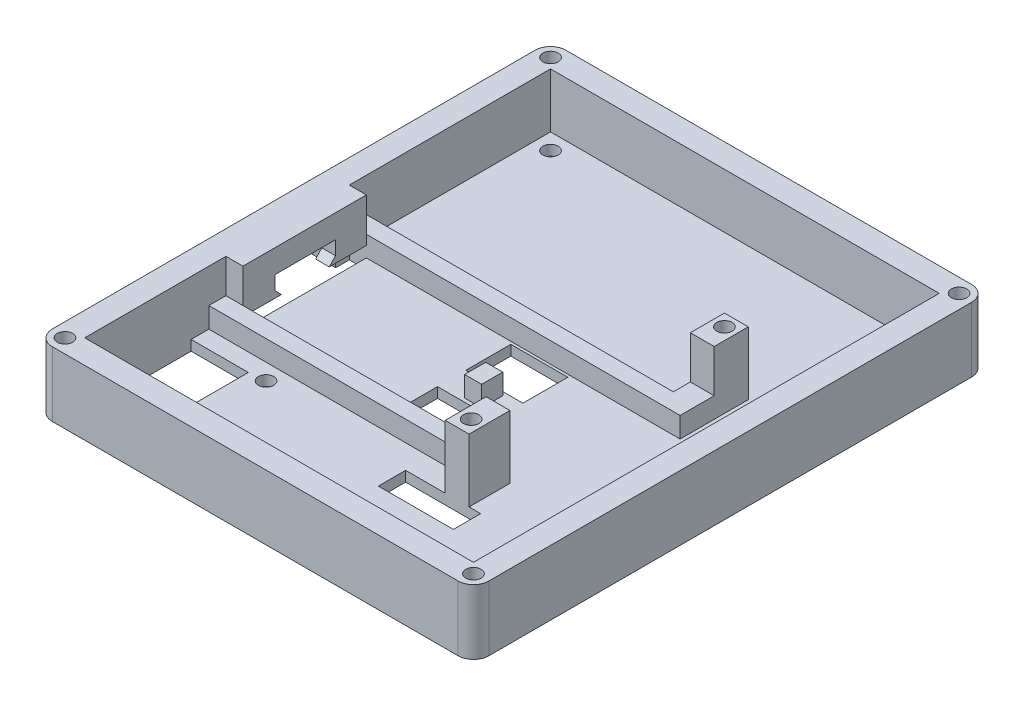
from build123d import *

# Parameters (mm, degrees)
SKETCH2_W              = 64
SKETCH2_H              = 75.2942
BASE_DEPTH             = 1.5
SKETCH6_W              = 64
SKETCH6_H              = 75.2942
SKETCH6_W_2            = 57
SKETCH6_H_2            = 68.2942
OUTSIDE_WALLS_DEPTH    = 8
SKETCH3_W              = 44.5
SKETCH3_H              = 2.5
SKETCH3_W_2            = 37.65
DIVIDER_WALLS_DEPTH    = 3
USB_START              = 0.160298289
USB_HOLE_DEPTH         = 13.899833209
SKETCH10_W             = 3.5
SKETCH10_H             = 3.5
BATT_MT3608_STOP_DEPTH = 3
TP4056_START           = 18.414945084
TP4056_STOP_OUTLINE_W  = 2.5
TP4056_STOP_OUTLINE_H  = 3.0942
TP4056_STOP_DEPTH      = 3
WIRE_START             = 20.416440404
WIRE_HOLES_OUTLINE_W   = 1.5
WIRE_HOLES_OUTLINE_H   = 6.588
WIRE_HOLES_DEPTH       = 8.3622
WIRE_START_2           = -3.642059596
WIRE_HOLES_2_OUTLINE_W = 1.5
WIRE_HOLES_2_OUTLINE_H = 13
WIRE_HOLES_2_DEPTH     = 8.390953786
WIRE_START_3           = 28.707940404
WIRE_HOLES_3_OUTLINE_W = 1.5
WIRE_HOLES_3_OUTLINE_H = 4
WIRE_HOLES_3_DEPTH     = 11
WIRE_START_4           = 4.74889419
WIRE_HOLES_4_OUTLINE_W = 1.5
WIRE_HOLES_4_OUTLINE_H = 4.98430333
WIRE_HOLES_4_DEPTH     = 8.028885191
USB_HOOD_DEPTH         = 2.5
USB_BACKING_DEPTH      = 2
SKETCH19_W             = 2.5
SKETCH19_H             = 18.0942
CUT_EXTRUDE2_DEPTH     = 1.5
SKETCH16_R             = 1.125
SCREW_HOLES_DEPTH      = 6
FILLET1_R              = 2.25
BOSS_EXTRUDE3_START    = 6.25
SKETCH17_W             = 3.5
SKETCH17_H             = 6
SKETCH17_R             = 1.125
SKETCH17_H_2           = 5
BOSS_EXTRUDE3_DEPTH    = 6.25
SKETCH18_R             = 1.125
CUT_EXTRUDE1_DEPTH     = 1.5


# Read off the part's stored shape, not the designer's step: USB Hole, TP4056 Stop, Wire Holes
with BuildPart() as part:
    # Sketch2 → Base (new body)
    with BuildSketch(Plane.XZ.offset(-18.414945084)):
        with Locations((24.857940404, 2.802763775)):
            Rectangle(SKETCH2_W, SKETCH2_H)
    extrude(amount=BASE_DEPTH)

    # Sketch6 → Outside Walls (add)
    with BuildSketch(Plane(origin=(0, 18.414945084, 0), x_dir=(1, 0, 0), z_dir=(0, 1, 0))):
        with Locations((24.857940404, -2.802763775)):
            Rectangle(SKETCH6_W, SKETCH6_H)
        with Locations((24.857940404, -2.802763775)):
            Rectangle(SKETCH6_W_2, SKETCH6_H_2, mode=Mode.SUBTRACT)
    extrude(amount=OUTSIDE_WALLS_DEPTH)

    # Sketch3 → Divider Walls (add)
    with BuildSketch(Plane(origin=(0, 18.414945084, 0), x_dir=(1, 0, 0), z_dir=(0, 1, 0))):
        with Locations((18.607940404, 3.094336225)):
            Rectangle(SKETCH3_W, SKETCH3_H)
        with Locations((15.182940404, -17.499863775)):
            Rectangle(SKETCH3_W_2, SKETCH3_H)
    extrude(amount=DIVIDER_WALLS_DEPTH)

    # USB Hole outline → USB Hole (cut)
    with BuildSketch(Plane.XY.offset(USB_START)):
        Polygon((-3.142059596, 16.914945084), (-3.142059596, 18.414945084), (-3.642059596, 18.414945084), (-3.642059596, 25.689688961), (-7.142059596, 25.689688961), (-7.142059596, 16.914945084), align=None)
    extrude(amount=USB_HOLE_DEPTH, mode=Mode.SUBTRACT)

    # Sketch10 → Batt & MT3608 Stop (add)
    with BuildSketch(Plane(origin=(0, 18.414945084, 0), x_dir=(1, 0, 0), z_dir=(0, 1, 0))):
        Polygon((44.857940404, 1.844336225), (40.857940404, 1.844336225), (40.857940404, 4.344336225), (41.357940404, 4.344336225), (41.357940404, 11.844336225), (44.857940404, 11.844336225), align=None)
        Polygon((34.507940404, -18.749863775), (34.007940404, -18.749863775), (34.007940404, -16.249863775), (38.007940404, -16.249863775), (38.007940404, -22.249863775), (34.507940404, -22.249863775), align=None)
        with Locations((36.257940404, -35.199863775)):
            Rectangle(SKETCH10_W, SKETCH10_H)
    extrude(amount=BATT_MT3608_STOP_DEPTH)

    # TP4056 Stop outline → TP4056 Stop (add)
    with BuildSketch(Plane(origin=(0, 0, 0), x_dir=(1, 0, 0), z_dir=(0, 1, 0)).offset(TP4056_START)):
        with Locations((25.107940404, -7.202763775)):
            Rectangle(TP4056_STOP_OUTLINE_W, TP4056_STOP_OUTLINE_H)
    extrude(amount=TP4056_STOP_DEPTH)

    # Wire Holes outline → Wire Holes (cut)
    with BuildSketch(Plane.YZ.offset(WIRE_START)):
        with Locations((17.664945084, 12.574863775)):
            Rectangle(WIRE_HOLES_OUTLINE_W, WIRE_HOLES_OUTLINE_H)
        with Locations((17.664945084, 1.830663775)):
            Rectangle(WIRE_HOLES_OUTLINE_W, WIRE_HOLES_OUTLINE_H)
    extrude(amount=WIRE_HOLES_DEPTH, mode=Mode.SUBTRACT)

    # Wire Holes 2 outline → Wire Holes 2 (cut)
    with BuildSketch(Plane.YZ.offset(WIRE_START_2)):
        with Locations((17.664945084, 27.849863775)):
            Rectangle(WIRE_HOLES_2_OUTLINE_W, WIRE_HOLES_2_OUTLINE_H)
    extrude(amount=WIRE_HOLES_2_DEPTH, mode=Mode.SUBTRACT)

    # Wire Holes 3 outline → Wire Holes 3 (cut)
    with BuildSketch(Plane.YZ.offset(WIRE_START_3)):
        with Locations((17.664945084, 24.249863775)):
            Rectangle(WIRE_HOLES_3_OUTLINE_W, WIRE_HOLES_3_OUTLINE_H)
        with Locations((17.664945084, 31.449863775)):
            Rectangle(WIRE_HOLES_3_OUTLINE_W, WIRE_HOLES_3_OUTLINE_H)
    extrude(amount=WIRE_HOLES_3_DEPTH, mode=Mode.SUBTRACT)

    # Wire Holes 4 outline → Wire Holes 4 (cut)
    with BuildSketch(Plane.YZ.offset(WIRE_START_4)):
        with Locations((17.664945084, 32.272120623)):
            Rectangle(WIRE_HOLES_4_OUTLINE_W, WIRE_HOLES_4_OUTLINE_H)
    extrude(amount=WIRE_HOLES_4_DEPTH, mode=Mode.SUBTRACT)

    # Sketch14 → USB Hood (add)
    with BuildSketch(Plane(origin=(-3.642059596, 0, 0), x_dir=(0, 0, -1), z_dir=(1, 0, 0))):
        Polygon((-14.060131498, 19.989745084), (-14.060131498, 25.689688961), (-0.160298289, 25.689688961), (-0.160298289, 19.989745084), (1.844336225, 19.989745084), (1.844336225, 26.414945084), (-16.249863775, 26.414945084), (-16.249863775, 19.989745084), align=None)
    extrude(amount=USB_HOOD_DEPTH)

    # Sketch15 → USB Backing (add)
    with BuildSketch(Plane(origin=(-1.142059596, 0, 0), x_dir=(0, 0, -1), z_dir=(1, 0, 0))):
        Polygon((-2.681738903, 22.989735785), (-2.681738903, 20.961450556), (-3.59783083, 19.989745084), (-0.160298289, 19.989745084), (-0.160298289, 25.689688961), (-14.060131498, 25.689688961), (-14.060131498, 19.989745084), (-10.622685302, 19.989745084), (-11.538656584, 20.961320912), (-11.538656584, 22.989735785), align=None)
    extrude(amount=-USB_BACKING_DEPTH)

    # Sketch19 → Cut-Extrude2 (cut)
    with BuildSketch(Plane(origin=(0, 18.414945084, 0), x_dir=(1, 0, 0), z_dir=(0, 1, 0))):
        with Locations((-2.392059596, -7.202763775)):
            Rectangle(SKETCH19_W, SKETCH19_H)
    extrude(amount=-CUT_EXTRUDE2_DEPTH, mode=Mode.SUBTRACT)

    # Sketch16 → Screw Holes (cut)
    with BuildSketch(Plane(origin=(0, 26.414945084, 0), x_dir=(1, 0, 0), z_dir=(0, 1, 0))):
        with Locations(Location((-5.091807064, 32.794083694, 0), (0, 0, 180))):
            Circle(SKETCH16_R)
        with Locations((54.807687872, 32.794083694)):
            Circle(SKETCH16_R)
        with Locations((-5.091807064, -38.399611243)):
            Circle(SKETCH16_R)
        with Locations(Location((54.807687872, -38.399611243, 0), (0, 0, 180))):
            Circle(SKETCH16_R)
        with Locations(Location((43.107940404, 10.094336225, 0), (0, 0, 180))):
            Circle(SKETCH16_R)
        with Locations(Location((36.257940404, -20.199611243, 0), (0, 0, 180))):
            Circle(SKETCH16_R)
    extrude(amount=-SCREW_HOLES_DEPTH, mode=Mode.SUBTRACT)

    # Fillet1
    fillet1_edges = [part.edges().sort_by_distance(p)[0] for p in [
        (-7.142059596, 21.664945084, 40.449863775),
        (-7.142059596, 21.664945084, -34.844336225),
        (56.857940404, 21.664945084, -34.844336225),
        (56.857940404, 21.664945084, 40.449863775),
    ]]
    fillet(fillet1_edges, radius=FILLET1_R)

    # Sketch17 → Boss-Extrude3 (add)
    # profile 1 of 2: a face of its own
    with BuildSketch(Plane(origin=(0, 21.414945084, 0), x_dir=(1, 0, 0), z_dir=(0, 1, 0)).offset(BOSS_EXTRUDE3_START)):
        with Locations((36.257940404, -19.249863775)):
            Rectangle(SKETCH17_W, SKETCH17_H)
        with Locations(Location((36.257940404, -20.199611243, 0), (0, 0, 180))):
            Circle(SKETCH17_R, mode=Mode.SUBTRACT)
    # profile 2 of 2: a face of its own
    with BuildSketch(Plane(origin=(0, 21.414945084, 0), x_dir=(1, 0, 0), z_dir=(0, 1, 0)).offset(BOSS_EXTRUDE3_START)):
        with Locations((43.107940404, 9.344336225)):
            Rectangle(SKETCH17_W, SKETCH17_H_2)
        with Locations(Location((43.107940404, 10.094336225, 0), (0, 0, 180))):
            Circle(SKETCH17_R, mode=Mode.SUBTRACT)
    extrude(amount=-BOSS_EXTRUDE3_DEPTH)

    # Sketch18 → Cut-Extrude1 (cut)
    with BuildSketch(Plane.XZ.offset(-16.914945084)):
        with Locations((50.982940404, 34.574863775)):
            Circle(SKETCH18_R)
        with Locations((50.982940404, 2.802763775)):
            Circle(SKETCH18_R)
        with Locations((50.982940404, -28.969336225)):
            Circle(SKETCH18_R)
        with Locations((-1.267059596, -28.969336225)):
            Circle(SKETCH18_R)
        with Locations((7.12389419, 21.124863775)):
            Circle(SKETCH18_R)
    extrude(amount=-CUT_EXTRUDE1_DEPTH, mode=Mode.SUBTRACT)


solid = part.part
